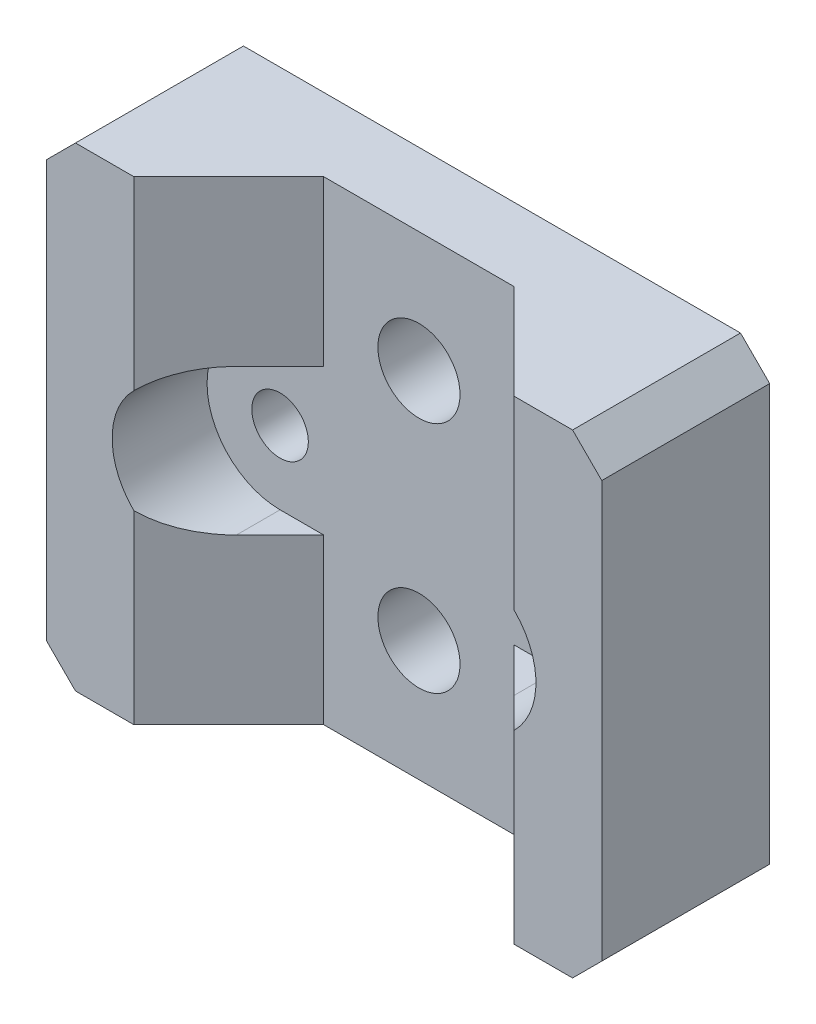
from build123d import *

# Parameters (mm, degrees)
SKETCH1_W                 = 48.308864232
SKETCH1_H                 = 41.275
BOSS_EXTRUDE1_DEPTH       = 6.35
F_8_CLEARANCE_HOLE1_D     = 4.9149
F_1_4_CLEARANCE_HOLE1_D   = 7.14248
SKETCH9_W                 = 6.35
SKETCH9_H                 = 41.275
EXTRUDE_THIN1_DEPTH       = 8.255
CHAMFER2_SIZE             = 9.525
CUT_EXTRUDE1_DEPTH        = 156.127382276
CHAMFER1_SIZE             = 2.54
HOLE1_AT_2_COUNT          = 2
HOLE1_AT_2_PITCH          = 9.3599
F_2_CLEARANCE_HOLE1_D     = 2.7051
F_2_CLEARANCE_HOLE1_DEPTH = 3.175
CHAMFER3_SIZE             = 1.27


with BuildPart() as part:
    # Sketch1 → Boss-Extrude1 (new body)
    with BuildSketch(Plane.XY):
        with Locations((-124.004465969, -24.5875)):
            Rectangle(SKETCH1_W, SKETCH1_H)
    extrude(amount=BOSS_EXTRUDE1_DEPTH)

    # #8 Clearance Hole1 (through all)
    with Locations(Plane.XY.offset(6.35)):
        with Locations((-111.927249911, -24.5875), (-136.081682027, -24.5875)):
            Hole(F_8_CLEARANCE_HOLE1_D / 2)

    # 1/4 Clearance Hole1 (through all)
    with Locations(Plane.XY.offset(6.35)):
        with Locations((-124.004465969, -14.4275), (-124.004465969, -34.7475)):
            Hole(F_1_4_CLEARANCE_HOLE1_D / 2)

    # Sketch9 → Extrude-Thin1 (add)
    with BuildSketch(Plane.XY.offset(6.35)):
        with Locations((-103.025033853, -24.5875)):
            Rectangle(SKETCH9_W, SKETCH9_H)
        with Locations((-144.983898085, -24.5875)):
            Rectangle(SKETCH9_W, SKETCH9_H)
    extrude(amount=EXTRUDE_THIN1_DEPTH)

    # Chamfer2
    # the kernel refuses this chamfer: 9.525 mm, written as the material it adds along each edge
    with BuildSketch(Plane(origin=(-106.200033853, -3.95, 6.35), x_dir=(0.0274958766105871, 0, 0.9996219169112966), z_dir=(0, -1, 0))) as chamfer2_piece_1_section:
        Polygon((CHAMFER2_SIZE * 0.999621916911, CHAMFER2_SIZE * 0.0274958766106), (-CHAMFER2_SIZE * 0.0274958766106, CHAMFER2_SIZE * 0.999621916911), (0, 0), align=None)
    chamfer2_piece_1 = extrude(amount=41.275, mode=Mode.PRIVATE)
    chamfer2_piece_1 = chamfer2_piece_1 - Plane(origin=(-111.927249911, -24.5875, 9.368765613), x_dir=(-1, 0, 0), z_dir=(0, 0, -1)) * Cylinder(2.45745, 121, mode=Mode.PRIVATE)
    chamfer2_piece_1 = split(chamfer2_piece_1, bisect_by=Plane(origin=(-109.341812124, -24.58749874, 14.605), z_dir=(0, 0, -1)), keep=Keep.TOP, mode=Mode.PRIVATE)
    add(chamfer2_piece_1)
    with BuildSketch(Plane(origin=(-141.808898085, -45.225, 6.35), x_dir=(0.9996219169112968, 0, -0.027495876610586386), z_dir=(0, 1, 0))) as chamfer2_piece_2_section:
        Polygon((CHAMFER2_SIZE * 0.999621916911, -CHAMFER2_SIZE * 0.0274958766106), (-CHAMFER2_SIZE * 0.0274958766106, -CHAMFER2_SIZE * 0.999621916911), (0, 0), align=None)
    chamfer2_piece_2 = extrude(amount=41.275, mode=Mode.PRIVATE)
    chamfer2_piece_2 = chamfer2_piece_2 - Plane(origin=(-136.081682027, -24.5875, 9.368765819), x_dir=(-1, 0, 0), z_dir=(0, 0, -1)) * Cylinder(2.45745, 121, mode=Mode.PRIVATE)
    chamfer2_piece_2 = split(chamfer2_piece_2, bisect_by=Plane(origin=(-138.667118685, -24.587501904, 14.605), z_dir=(0, 0, -1)), keep=Keep.TOP, mode=Mode.PRIVATE)
    add(chamfer2_piece_2)

    # Sketch10 → Cut-Extrude1 (cut, through all)
    with BuildSketch(Plane.XY.offset(6.35)):
        with BuildLine():
            Line((-136.081682027, -18.2375), (-111.927249911, -18.2375))
            ThreePointArc((-111.927249911, -18.2375), (-105.577249911, -24.5875), (-111.927249911, -30.9375))
            Line((-111.927249911, -30.9375), (-136.081682027, -30.9375))
            ThreePointArc((-136.081682027, -30.9375), (-142.431682027, -24.5875), (-136.081682027, -18.2375))
        make_face()
    extrude(amount=CUT_EXTRUDE1_DEPTH, mode=Mode.SUBTRACT)

    # Chamfer1
    chamfer1_edges = [part.edges().sort_by_distance(p)[0] for p in [
        (-99.850033853, -45.225, 7.3025),
        (-148.158898085, -45.225, 7.3025),
        (-148.158898085, -3.95, 7.3025),
        (-99.850033853, -3.95, 7.3025),
    ]]
    chamfer(chamfer1_edges, length=CHAMFER1_SIZE)

    # Sketch12 → Hole1 (revolve, cut)
    with BuildSketch(Plane(origin=(-148.158898085, -26.4544, 7.4422), x_dir=(0, 0, 1), z_dir=(0, 1, 0))):
        Polygon((0, 0), (0, 2.921), (1.4986, 2.921), (1.6383, 0), align=None)
    hole1 = revolve(axis=Axis((-38.158898085, -26.4544, 7.4422), (-1, 0, 0)), mode=Mode.SUBTRACT)

    # Hole1 at 2: Hole1 ×2
    with Locations(*[(0, i * HOLE1_AT_2_PITCH, 0) for i in range(1, HOLE1_AT_2_COUNT)]):
        add(hole1, mode=Mode.SUBTRACT)

    # #2 Clearance Hole1
    with Locations(Plane.ZY.offset(148.158898085)):
        with Locations((7.4422, -17.0945), (7.4422, -26.4544)):
            Hole(F_2_CLEARANCE_HOLE1_D / 2, depth=F_2_CLEARANCE_HOLE1_DEPTH)

    # Chamfer3
    chamfer3_edges = [part.edges().sort_by_distance(p)[0] for p in [
        (-120.433225969, -34.7475, 0),
        (-120.433225969, -14.4275, 0),
    ]]
    chamfer(chamfer3_edges, length=CHAMFER3_SIZE)


solid = part.part
